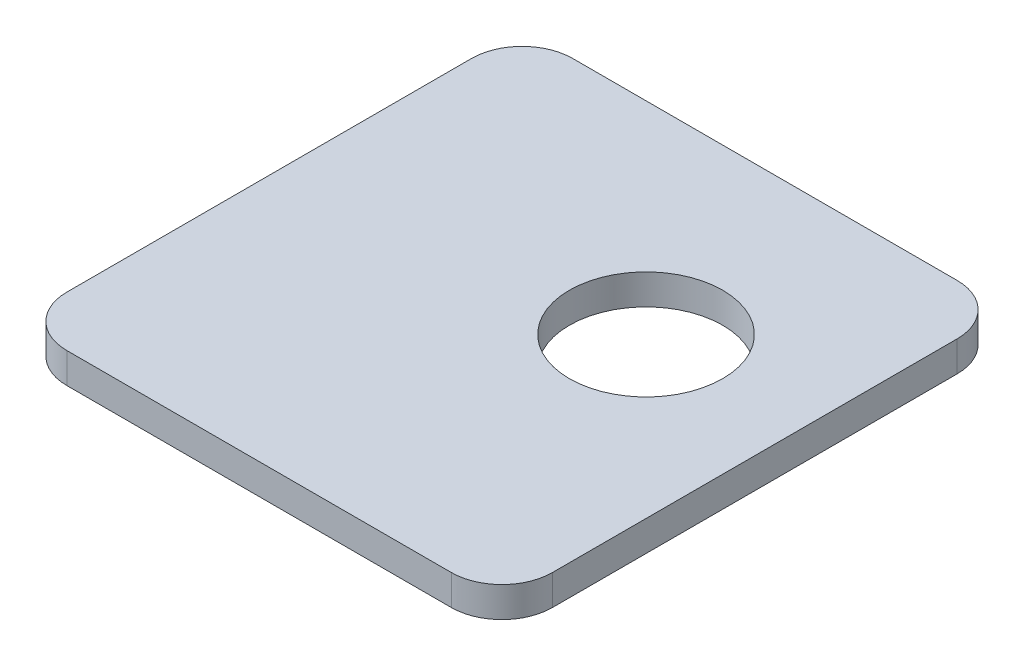
from build123d import *

# Parameters (mm, degrees)
SKETCH1_R           = 7.575
BOSS_EXTRUDE1_DEPTH = 3


with BuildPart() as part:
    # Sketch1 → Boss-Extrude1 (new body)
    with BuildSketch(Plane(origin=(0, 0, 0), x_dir=(1, 0, 0), z_dir=(0, 1, 0))):
        with BuildLine():
            Line((-19.42229117, 29.206654834), (18.57770883, 29.206654834))
            ThreePointArc((18.57770883, 29.206654834), (22.113242736, 27.74218874), (23.57770883, 24.206654834))
            Line((23.57770883, 24.206654834), (23.57770883, -15.793345166))
            ThreePointArc((23.57770883, -15.793345166), (22.113242736, -19.328879072), (18.57770883, -20.793345166))
            Line((18.57770883, -20.793345166), (-19.42229117, -20.793345166))
            ThreePointArc((-19.42229117, -20.793345166), (-22.957825076, -19.328879072), (-24.42229117, -15.793345166))
            Line((-24.42229117, -15.793345166), (-24.42229117, 24.206654834))
            ThreePointArc((-24.42229117, 24.206654834), (-22.957825076, 27.74218874), (-19.42229117, 29.206654834))
        make_face()
        with Locations((7.824699405, 9.208291295)):
            Circle(SKETCH1_R, mode=Mode.SUBTRACT)
    extrude(amount=BOSS_EXTRUDE1_DEPTH)


solid = part.part
